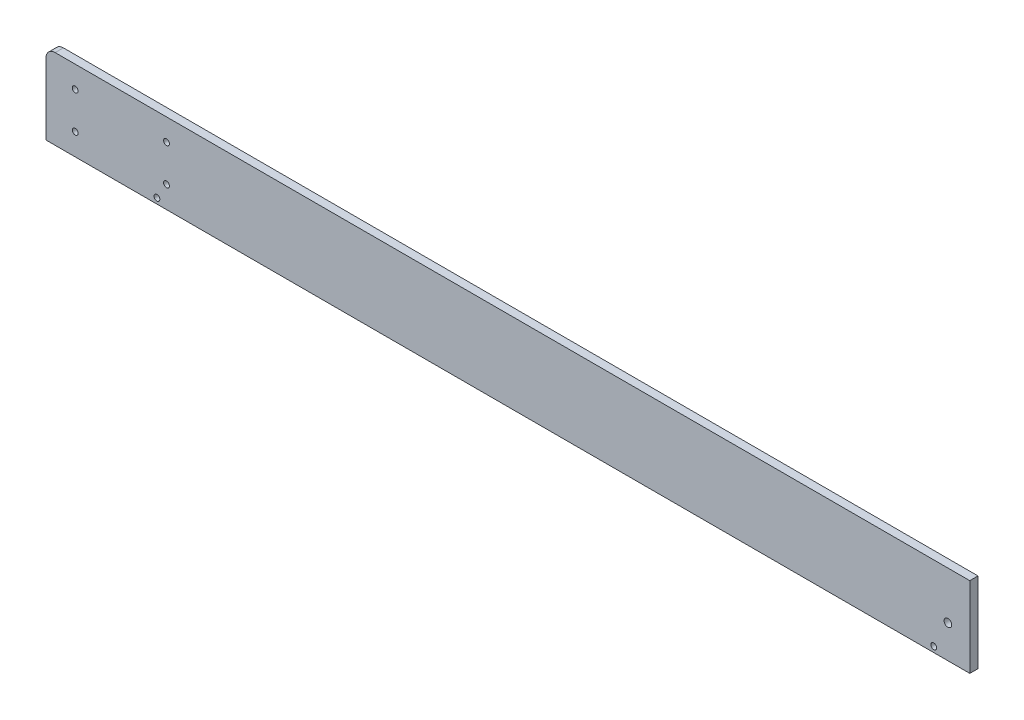
from build123d import *

# Parameters (mm, degrees)
SKETCH1_W           = 506
SKETCH1_H           = 44
SKETCH1_R           = 2.1
SKETCH1_R_2         = 1.6
BOSS_EXTRUDE1_DEPTH = 4.5
FILLET1_R           = 5


with BuildPart() as part:
    # Sketch1 → Boss-Extrude1 (new body)
    with BuildSketch(Plane.XY):
        Rectangle(SKETCH1_W, SKETCH1_H)
        with Locations((241, -4)):
            Circle(SKETCH1_R, mode=Mode.SUBTRACT)
        with Locations((-237, 10)):
            Circle(SKETCH1_R_2, mode=Mode.SUBTRACT)
        with Locations((-187, 10)):
            Circle(SKETCH1_R_2, mode=Mode.SUBTRACT)
        with Locations((-187, -10)):
            Circle(SKETCH1_R_2, mode=Mode.SUBTRACT)
        with Locations((-237, -10)):
            Circle(SKETCH1_R_2, mode=Mode.SUBTRACT)
        with Locations((233.25, -19)):
            Circle(SKETCH1_R_2, mode=Mode.SUBTRACT)
        with Locations((-192.25, -19)):
            Circle(SKETCH1_R_2, mode=Mode.SUBTRACT)
    extrude(amount=BOSS_EXTRUDE1_DEPTH)

    # Fillet1
    fillet1_edges = [part.edges().sort_by_distance(p)[0] for p in [
        (-253, 22, 2.25),
    ]]
    fillet(fillet1_edges, radius=FILLET1_R)


solid = part.part
